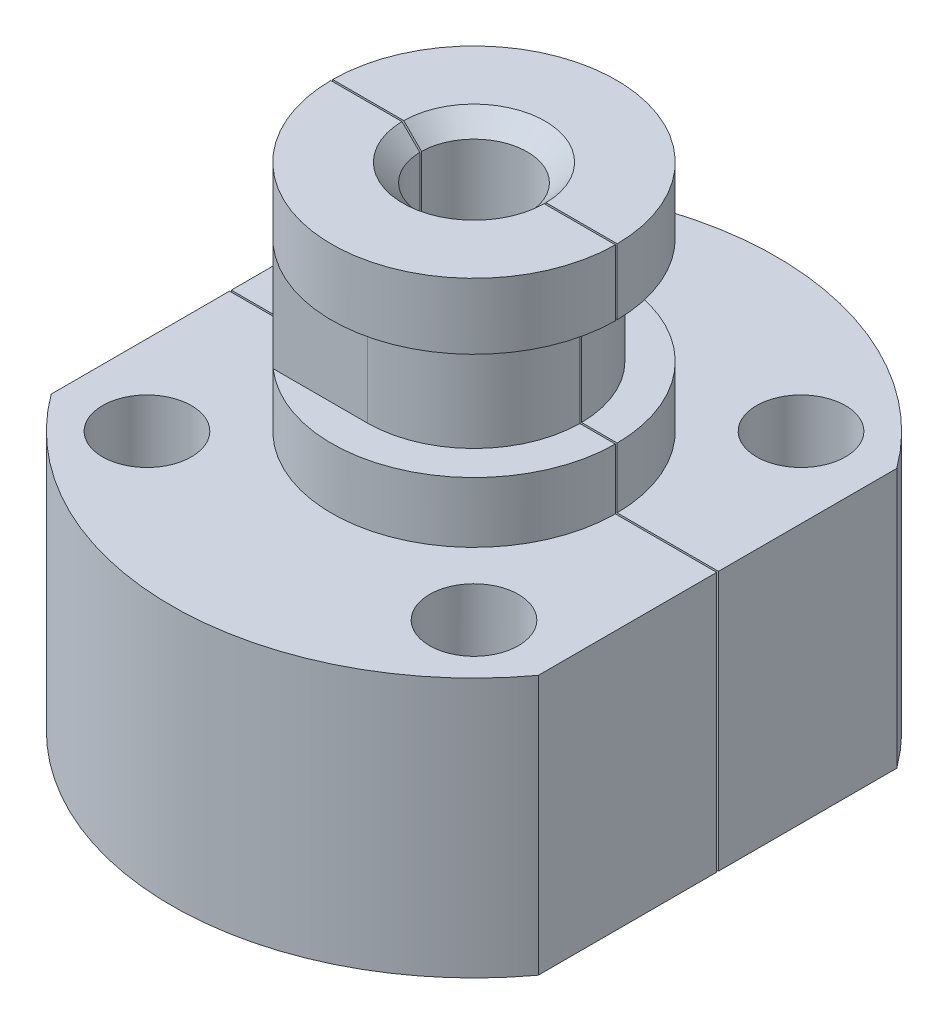
from build123d import *

# Parameters (mm, degrees)
SKETCH1_W               = 8.8
SKETCH1_H               = 6.2
CUT_EXTRUDE2_DEPTH      = 29.12756655
CUT_EXTRUDE2_DEPTH_BACK = 29.12756655
SKETCH4_R               = 1.45
SKETCH4_3_R             = 2.5
SKETCH4_3_R_2           = 1.45
CUT_EXTRUDE3_DEPTH      = 13.1
CHAMFER1_SIZE           = 1
BOSS_EXTRUDE1_START     = 6
BOSS_EXTRUDE1_DEPTH     = 6
CHAMFER2_SIZE           = 5.2
SKETCH2_W               = 100
SKETCH2_H               = 100
CUT_EXTRUDE1_DEPTH      = 0.05
CUT_EXTRUDE4_START      = -14.6
CUT_EXTRUDE4_DEPTH      = 14.6


# Read off the part's stored shape, not the designer's step: Cut-Extrude4
with BuildPart() as part:
    # Sketch1 → Revolve1 (revolve)
    with BuildSketch(Plane.XY, mode=Mode.PRIVATE) as revolve1_sk:
        Polygon((-3, -13.1), (-3, 0), (-8, 0), (-8, -3.7), (-6, -3.7), (-6, -9.7), (-8, -9.7), (-8, -13.1), align=None)
        Polygon((-3, -18.1), (-3, -13.1), (-8, -13.1), (-17, -13.1), (-17, -18.1), (-8.2, -18.1), align=None)
        with Locations((-12.6, -21.2)):
            Rectangle(SKETCH1_W, SKETCH1_H)
        Polygon((-6.2, -24.3), (-8.2, -24.3), (-17, -24.3), (-17, -27.7), (-6.2, -27.7), align=None)
    revolve(revolve1_sk.sketch.rotate(Axis((0, 21.737527327, 0), (0, -1, 0)), 270), axis=Axis((0, 21.737527327, 0), (0, -1, 0)))

    # Sketch4 → Cut-Extrude2 (cut, two sides: drawn at the far end of the back side and taken through both)
    with BuildSketch(Plane(origin=(0, -13.1, 0), x_dir=(1, 0, 0), z_dir=(0, 1, 0)).offset(-CUT_EXTRUDE2_DEPTH_BACK)):
        with Locations(Location((-9.192388155, 9.192388155, 0), (0, 0, 270))):
            Circle(SKETCH4_R)
        with Locations(Location((9.192388155, 9.192388155, 0), (0, 0, 270))):
            Circle(SKETCH4_R)
        with Locations(Location((9.192388155, -9.192388155, 0), (0, 0, 270))):
            Circle(SKETCH4_R)
        with Locations(Location((-9.192388155, -9.192388155, 0), (0, 0, 270))):
            Circle(SKETCH4_R)
    extrude(amount=CUT_EXTRUDE2_DEPTH + CUT_EXTRUDE2_DEPTH_BACK, mode=Mode.SUBTRACT)

    # Sketch4<3> → Cut-Extrude3 (cut)
    # profile 1 of 5: a face of its own
    with BuildSketch(Plane(origin=(0, -13.1, 0), x_dir=(1, 0, 0), z_dir=(0, 1, 0))):
        with Locations(Location((9.192388155, 9.192388155, 0), (0, 0, 270))):
            Circle(SKETCH4_3_R)
        with Locations(Location((9.192388155, 9.192388155, 0), (0, 0, 270))):
            Circle(SKETCH4_3_R_2, mode=Mode.SUBTRACT)
    # profile 2 of 5: a face of its own
    with BuildSketch(Plane(origin=(0, -13.1, 0), x_dir=(1, 0, 0), z_dir=(0, 1, 0))):
        with Locations(Location((9.192388155, -9.192388155, 0), (0, 0, 270))):
            Circle(SKETCH4_3_R)
        with Locations(Location((9.192388155, -9.192388155, 0), (0, 0, 270))):
            Circle(SKETCH4_3_R_2, mode=Mode.SUBTRACT)
    # profile 3 of 5: a face of its own
    with BuildSketch(Plane(origin=(0, -13.1, 0), x_dir=(1, 0, 0), z_dir=(0, 1, 0))):
        with Locations(Location((-9.192388155, -9.192388155, 0), (0, 0, 270))):
            Circle(SKETCH4_3_R)
        with Locations(Location((-9.192388155, -9.192388155, 0), (0, 0, 270))):
            Circle(SKETCH4_3_R_2, mode=Mode.SUBTRACT)
    # profile 4 of 5: a face of its own
    with BuildSketch(Plane(origin=(0, -13.1, 0), x_dir=(1, 0, 0), z_dir=(0, 1, 0))):
        with Locations(Location((-9.192388155, 9.192388155, 0), (0, 0, 270))):
            Circle(SKETCH4_3_R_2)
    # profile 5 of 5: a face of its own
    with BuildSketch(Plane(origin=(0, -13.1, 0), x_dir=(1, 0, 0), z_dir=(0, 1, 0))):
        with Locations(Location((-9.192388155, 9.192388155, 0), (0, 0, 270))):
            Circle(SKETCH4_3_R)
    extrude(amount=-CUT_EXTRUDE3_DEPTH, mode=Mode.SUBTRACT)

    # Chamfer1
    chamfer1_edges = [part.edges().sort_by_distance(p)[0] for p in [
        (0, 0, -3),
    ]]
    chamfer(chamfer1_edges, length=CHAMFER1_SIZE)

    # Sketch5 → Boss-Extrude1 (add)
    with BuildSketch(Plane.XZ.offset(3.7).offset(BOSS_EXTRUDE1_START)):
        with BuildLine():
            Line((0, 6), (-5.291502622, 6))
            ThreePointArc((-5.291502622, 6), (-5.39659218, 5.905657698), (-5.5, 5.809475019))
            Line((-5.5, 5.809475019), (-5.5, 2.397915762))
            ThreePointArc((-5.5, 2.397915762), (-3.287286528, 5.019337335), (0, 6))
        make_face()
        with BuildLine():
            Line((-5.5, -2.397915762), (-5.5, -5.809475019))
            ThreePointArc((-5.5, -5.809475019), (-5.39659218, -5.905657698), (-5.291502622, -6))
            Line((-5.291502622, -6), (0, -6))
            ThreePointArc((0, -6), (-3.287286528, -5.019337335), (-5.5, -2.397915762))
        make_face()
    extrude(amount=-BOSS_EXTRUDE1_DEPTH)

    # Chamfer2
    chamfer2_edges = [part.edges().sort_by_distance(p)[0] for p in [
        (0, -18.1, -3),
    ]]
    chamfer(chamfer2_edges, length=CHAMFER2_SIZE - 0.0001)  # a hair under: the kernel refuses the full size

    # Sketch2 → Cut-Extrude1 (cut, symmetric)
    with BuildSketch(Plane.XY):
        Rectangle(SKETCH2_W, SKETCH2_H)
    extrude(amount=CUT_EXTRUDE1_DEPTH, both=True, mode=Mode.SUBTRACT)


with BuildPart() as cut_extrude1_piece_1:
    # of the separate pieces the step leaves, piece 1, a body of its own (cut_extrude1_pieces)
    add(part.part.solids().sort_by_distance((-2.999583304, -12.9001, -0.05))[0])


with BuildPart() as cut_extrude1_piece_2:
    # of the separate pieces the step leaves, piece 2, a body of its own (cut_extrude1_pieces)
    add(part.part.solids().sort_by_distance((2.999583304, -12.9001, 0.05))[0])


with BuildPart() as cut_extrude4_tool:
    # Cut-Extrude4 outline → Cut-Extrude4 (new body)
    with BuildSketch(Plane(origin=(0, -13.1, 0), x_dir=(1, 0, 0), z_dir=(0, 1, 0)).offset(CUT_EXTRUDE4_START)):
        with BuildLine():
            ThreePointArc((16.99992647, 0.05), (16.144129117, 5.326076892), (13.692388155, 10.075639265))
            Line((13.692388155, 10.075639265), (13.692388155, 0.05))
            Line((13.692388155, 0.05), (16.99992647, 0.05))
        make_face()
        with BuildLine():
            Line((-13.692388155, 0.05), (-13.692388155, 10.075639265))
            ThreePointArc((-13.692388155, 10.075639265), (-16.144129117, 5.326076892), (-16.99992647, 0.05))
            Line((-16.99992647, 0.05), (-13.692388155, 0.05))
        make_face()
        with BuildLine():
            Line((13.692388155, -0.05), (13.692388155, -10.075639265))
            ThreePointArc((13.692388155, -10.075639265), (16.144129117, -5.326076892), (16.99992647, -0.05))
            Line((16.99992647, -0.05), (13.692388155, -0.05))
        make_face()
        with BuildLine():
            Line((-13.692388155, -10.075639265), (-13.692388155, -0.05))
            Line((-13.692388155, -0.05), (-16.99992647, -0.05))
            ThreePointArc((-16.99992647, -0.05), (-16.144129117, -5.326076892), (-13.692388155, -10.075639265))
        make_face()
    extrude(amount=CUT_EXTRUDE4_DEPTH)


with BuildPart() as cut_extrude1_piece_1_1:
    add(cut_extrude1_piece_1.part)

    # Cut-Extrude4: cut by cut_extrude4_tool
    add(cut_extrude4_tool.part, mode=Mode.SUBTRACT)


with BuildPart() as cut_extrude1_piece_2_1:
    add(cut_extrude1_piece_2.part)

    # Cut-Extrude4: cut by cut_extrude4_tool
    add(cut_extrude4_tool.part, mode=Mode.SUBTRACT)


solid = Compound([cut_extrude1_piece_1_1.part, cut_extrude1_piece_2_1.part])
